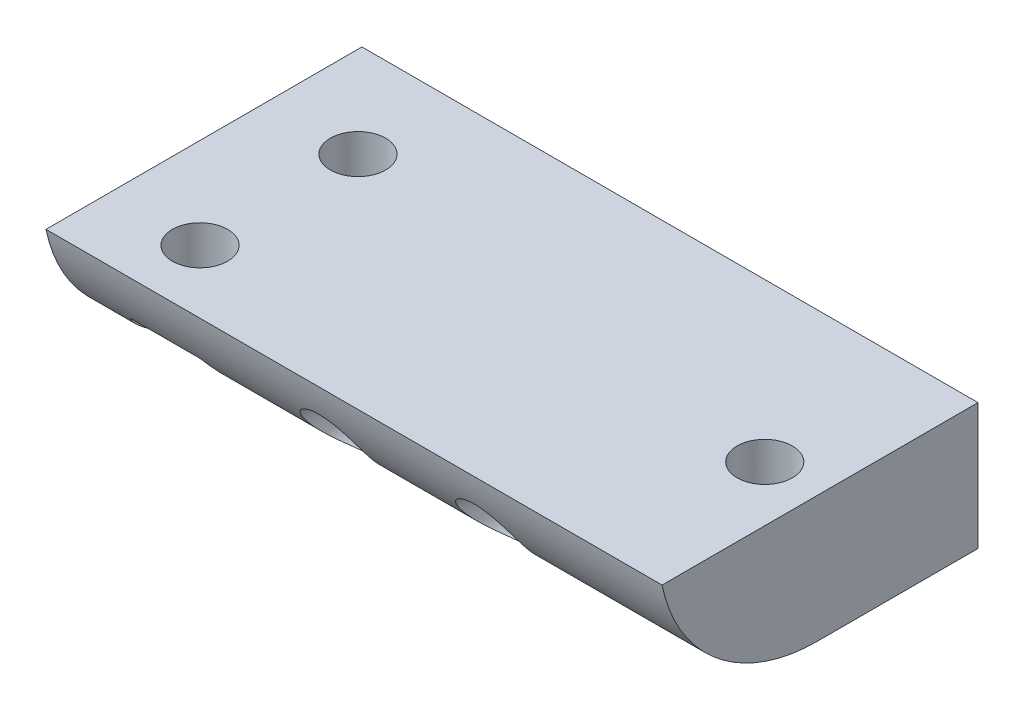
from build123d import *

# Parameters (mm, degrees)
SKETCH1_W               = 39
SKETCH1_H               = 8
SKETCH1_R               = 2
BOSS_EXTRUDE1_DEPTH     = 20
CUT_EXTRUDE3_REACH      = 40.878
SKETCH2_R               = 1.75
FILLET1_R               = 10
SKETCH3_R               = 3.1
CUT_EXTRUDE4_DEPTH      = 4
CUT_EXTRUDE6_DEPTH      = 69.640184916
CUT_EXTRUDE6_DEPTH_BACK = 69.640184916
SKETCH4_W               = 49.515831406
SKETCH4_H               = 28.781468371


with BuildPart() as part:
    # Sketch1 → Boss-Extrude1 (new body)
    with BuildSketch(Plane.XY):
        with Locations((12.864717907, 7.797867952)):
            Rectangle(SKETCH1_W, SKETCH1_H)
        with Locations((9.889717907, 7.547867952)):
            Circle(SKETCH1_R, mode=Mode.SUBTRACT)
        with Locations((19.739717907, 7.547867952)):
            Circle(SKETCH1_R, mode=Mode.SUBTRACT)
    extrude(amount=BOSS_EXTRUDE1_DEPTH)

    # Sketch2 → Cut-Extrude3 (cut, up to next)
    with BuildSketch(Plane(origin=(0, 11.797867952, 0), x_dir=(1, 0, 0), z_dir=(0, 1, 0)), mode=Mode.PRIVATE) as cut_extrude3_sk1:
        with Locations(Location((28.864717907, -10, 0), (0, 0, 270))):
            Circle(SKETCH2_R)
    cut_extrude3_tool1 = extrude(cut_extrude3_sk1.sketch, amount=-CUT_EXTRUDE3_REACH, mode=Mode.PRIVATE) & part.part
    # Sketch2 → Cut-Extrude3 (cut, up to next)
    with BuildSketch(Plane(origin=(0, 11.797867952, 0), x_dir=(1, 0, 0), z_dir=(0, 1, 0)), mode=Mode.PRIVATE) as cut_extrude3_sk2:
        with Locations(Location((-0.885282093, -14, 0), (0, 0, 270))):
            Circle(SKETCH2_R)
    cut_extrude3_tool2 = extrude(cut_extrude3_sk2.sketch, amount=-CUT_EXTRUDE3_REACH, mode=Mode.PRIVATE) & part.part
    # Sketch2 → Cut-Extrude3 (cut, up to next)
    with BuildSketch(Plane(origin=(0, 11.797867952, 0), x_dir=(1, 0, 0), z_dir=(0, 1, 0)), mode=Mode.PRIVATE) as cut_extrude3_sk3:
        with Locations(Location((-0.885282093, -4, 0), (0, 0, 270))):
            Circle(SKETCH2_R)
    cut_extrude3_tool3 = extrude(cut_extrude3_sk3.sketch, amount=-CUT_EXTRUDE3_REACH, mode=Mode.PRIVATE) & part.part
    add(cut_extrude3_tool1.solids().sort_by_distance((28.864718, 11.797868, 10))[0], mode=Mode.SUBTRACT)
    add(cut_extrude3_tool2.solids().sort_by_distance((-0.885282, 11.797868, 14))[0], mode=Mode.SUBTRACT)
    add(cut_extrude3_tool3.solids().sort_by_distance((-0.885282, 11.797868, 4))[0], mode=Mode.SUBTRACT)

    # Fillet1
    # the kernel refuses this fillet: 10 mm, written as the material it takes off along each edge
    with BuildSketch(Plane(origin=(56.859615335, 3.797867952, 0), x_dir=(0, 1, 0), z_dir=(-1, 0, 0))) as fillet1_piece_1:
        with BuildLine():
            CenterArc((10, -9.797958971), FILLET1_R, 101.536959033, 78.463040967)
            Line((0, -9.797958971), (-0.2, -9.797958971))
            Line((-0.2, -9.797958971), (-0.2, 0))
            Line((-0.2, 0), (0, 0.2))
            ThreePointArc((0, 0.2), (4, 0.2), (7.96, 0.195959179))
            Line((7.96, 0.195959179), (8, 0))
        make_face()
    extrude(amount=87.989794856, mode=Mode.SUBTRACT)

    # Sketch3 → Cut-Extrude4 (cut)
    with BuildSketch(Plane.XZ.offset(-3.797867952)):
        with Locations(Location((-0.885282093, 14, 0), (0, 0, 270))):
            Circle(SKETCH3_R)
        with Locations(Location((28.864717907, 10, 0), (0, 0, 270))):
            Circle(SKETCH3_R)
        with Locations((-0.885282093, 4)):
            Circle(SKETCH3_R)
    extrude(amount=-CUT_EXTRUDE4_DEPTH, mode=Mode.SUBTRACT)


with BuildPart() as body_2:
    # Mirror1: mirrored copy
    add(part.part.mirror(Plane.XY.offset(30)))


with BuildPart() as part_1:
    add(part.part)

    # Sketch4 → Cut-Extrude6 (cut, two sides: drawn at the far end of the back side and taken through both)
    with BuildSketch(Plane(origin=(0, 11.797867952, 0), x_dir=(1, 0, 0), z_dir=(0, 1, 0)).offset(-CUT_EXTRUDE6_DEPTH_BACK)):
        with Locations((14.166283804, -9.086507762)):
            Rectangle(SKETCH4_W, SKETCH4_H)
    extrude(amount=CUT_EXTRUDE6_DEPTH + CUT_EXTRUDE6_DEPTH_BACK, mode=Mode.SUBTRACT)


solid = body_2.part
